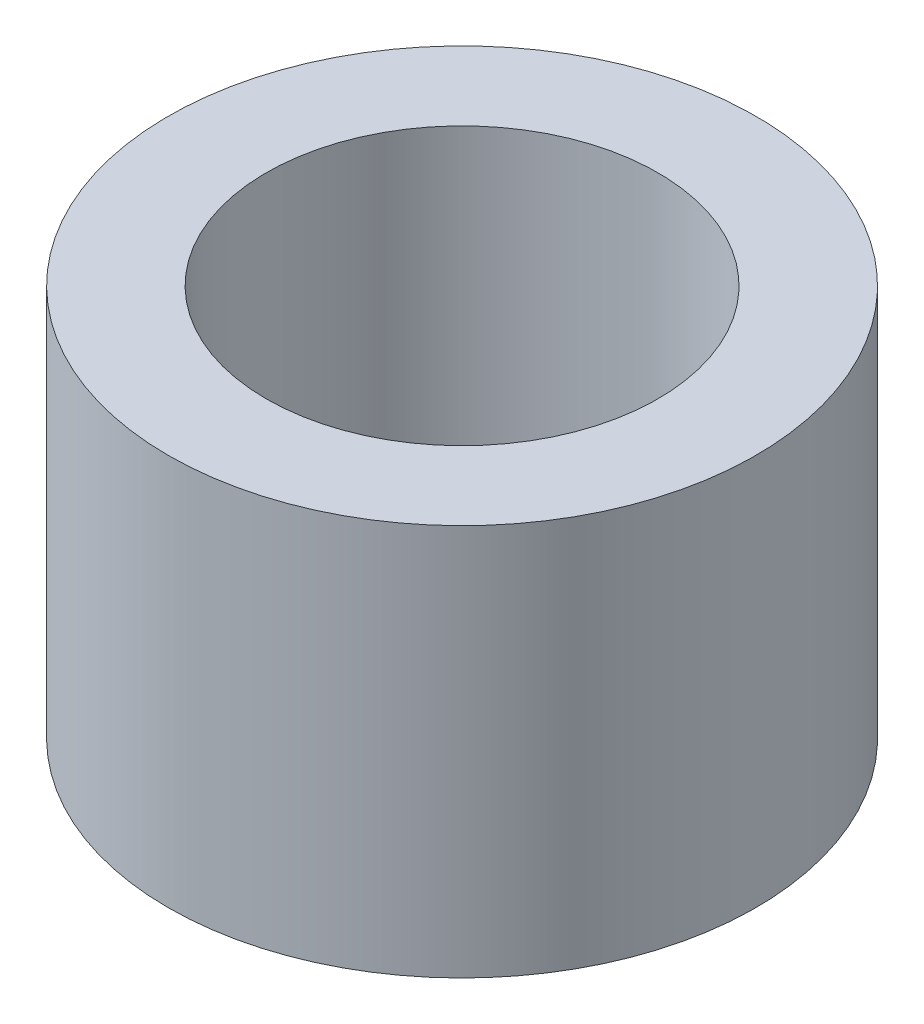
from build123d import *

# Parameters (mm, degrees)
SKETCH_1_R      = 3
SKETCH_1_R_2    = 2
EXTRUDE_1_DEPTH = 4


with BuildPart() as part:
    # 草图1 → 凸台-拉伸1 (new body)
    with BuildSketch(Plane(origin=(0, 0, 0), x_dir=(1, 0, 0), z_dir=(0, 1, 0))):
        Circle(SKETCH_1_R)
        Circle(SKETCH_1_R_2, mode=Mode.SUBTRACT)
    extrude(amount=EXTRUDE_1_DEPTH)


solid = part.part
